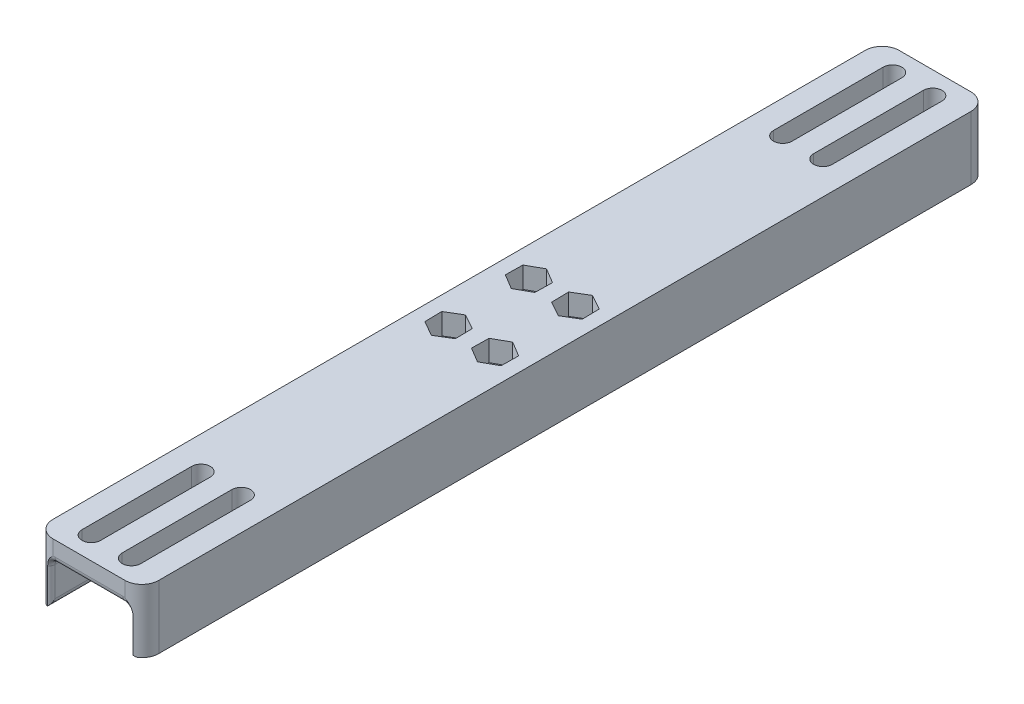
from build123d import *

# Parameters (mm, degrees)
SKETCH1_W           = 9.5
SKETCH1_H           = 100
SKETCH1_R           = 2.05
BOSS_EXTRUDE1_DEPTH = 15
CUT_EXTRUDE1_START  = -5
SKETCH2_R           = 2.05
CUT_EXTRUDE1_DEPTH  = 5
SKETCH3_W           = 11.226687125
SKETCH3_H           = 38.173064709
CUT_EXTRUDE2_DEPTH  = 10
SKETCH6_W           = 3
SKETCH6_H           = 100
BOSS_EXTRUDE2_DEPTH = 15
FILLET1_R           = 1.5
FILLET2_START       = -1
FILLET2_DEPTH       = 17


with BuildPart() as part:
    # Sketch1 → Boss-Extrude1 (new body)
    with BuildSketch(Plane(origin=(0, 0, 0), x_dir=(1, 0, 0), z_dir=(0, 1, 0))):
        with Locations((-4.75, -50)):
            Rectangle(SKETCH1_W, SKETCH1_H)
        with BuildLine():
            ThreePointArc((-2.55, -94.696458633), (-4.75, -96.896458633), (-6.95, -94.696458633))
            Line((-6.95, -94.696458633), (-6.95, -68.762531393))
            ThreePointArc((-6.95, -68.762531393), (-4.75, -66.562531393), (-2.55, -68.762531393))
            Line((-2.55, -68.762531393), (-2.55, -94.696458633))
        make_face(mode=Mode.SUBTRACT)
        with Locations(Location((-5.5, -9.5, 0), (0, 0, 270))):
            Circle(SKETCH1_R, mode=Mode.SUBTRACT)
    extrude(amount=BOSS_EXTRUDE1_DEPTH)

    # Sketch2 → Cut-Extrude1 (cut)
    with BuildSketch(Plane(origin=(0, 15, 0), x_dir=(1, 0, 0), z_dir=(0, 1, 0)).offset(CUT_EXTRUDE1_START)):
        Polygon((-9.015868986, -11.607604946), (-5.432695069, -13.598634331), (-1.916826083, -11.491029385), (-1.984131014, -7.392395054), (-5.567304931, -5.401365669), (-9.083173917, -7.508970615), align=None)
        with Locations(Location((-5.5, -9.5, 0), (0, 0, 270))):
            Circle(SKETCH2_R, mode=Mode.SUBTRACT)
    extrude(amount=CUT_EXTRUDE1_DEPTH, mode=Mode.SUBTRACT)

    # Sketch3 → Cut-Extrude2 (cut)
    with BuildSketch(Plane(origin=(0, 0, 0), x_dir=(1, 0, 0), z_dir=(0, 1, 0))):
        with Locations((-5.613343563, -80.913467646)):
            Rectangle(SKETCH3_W, SKETCH3_H)
    extrude(amount=CUT_EXTRUDE2_DEPTH, mode=Mode.SUBTRACT)

    # Sketch6 → Boss-Extrude2 (add)
    with BuildSketch(Plane(origin=(0, 15, 0), x_dir=(1, 0, 0), z_dir=(0, 1, 0))):
        with Locations((-11, -50)):
            Rectangle(SKETCH6_W, SKETCH6_H)
    extrude(amount=-BOSS_EXTRUDE2_DEPTH)

    # Fillet1
    fillet1_edges = [part.edges().sort_by_distance(p)[0] for p in [
        (-4.75, 10, 61.826935291),
        (-9.5, 10, 80.913467645),
        (-4.75, 10, 100),
        (-4.75, 0, 61.826935291),
        (-9.5, 5, 61.826935291),
        (-9.5, 5, 100),
        (-9.5, 0, 80.913467645),
    ]]
    fillet(fillet1_edges, radius=FILLET1_R)

    # Fillet2: read off the stored shape, not the designer's step
    # Fillet2 outline → Fillet2 (cut)
    with BuildSketch(Plane(origin=(0, 0, 0), x_dir=(1, 0, 0), z_dir=(0, 1, 0)).offset(FILLET2_START)):
        with BuildLine():
            ThreePointArc((-8.5, -100), (-11.328427125, -98.828427125), (-12.5, -96))
            Line((-12.5, -96), (-12.5, -100))
            Line((-12.5, -100), (-8.5, -100))
        make_face()
    extrude(amount=FILLET2_DEPTH, mode=Mode.SUBTRACT)

    # Mirror1: part across plane


with BuildPart() as part_1:
    add(part.part)
    add(part.part.mirror(Plane(origin=(0, 15, 0), x_dir=(0, 0, 1), z_dir=(1, 0, 0))))

    # Mirror2: part across face


with BuildPart() as part_2:
    add(part_1.part)
    add(part_1.part.mirror(Plane(origin=(0, 7.5, 0), x_dir=(1, 0, 0), z_dir=(0, 0, -1))))


solid = part_2.part
